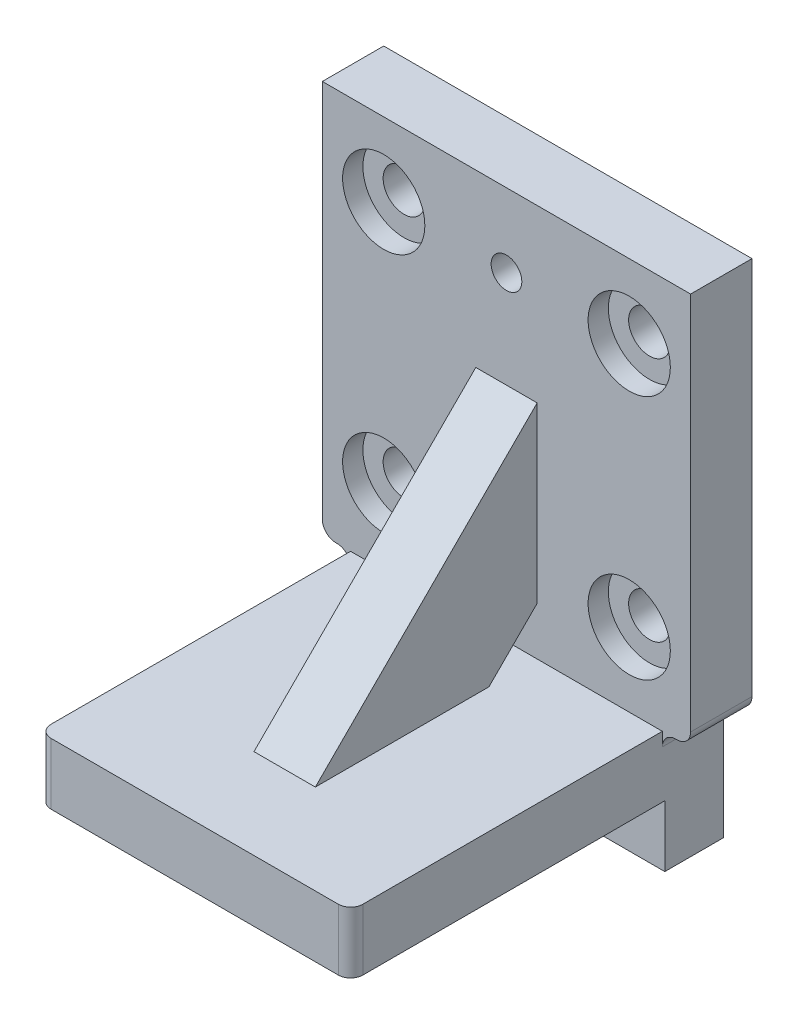
from build123d import *

# Parameters (mm, degrees)
SKETCH1_W                       = 30
SKETCH1_H                       = 32
BOSS_EXTRUDE1_DEPTH             = 5
CBORE_FOR_M3_SBHCS2_D           = 3.4
CBORE_FOR_M3_SBHCS2_CBORE_D     = 6.7
CBORE_FOR_M3_SBHCS2_CBORE_DEPTH = 1.65
TAP_DRILL_FOR_M3X0_5_TAP1_D     = 2.5
SKETCH5_W                       = 25.4
SKETCH5_H                       = 30.4
BOSS_EXTRUDE2_DEPTH             = 5
BOSS_EXTRUDE3_REACH             = 38.377
SKETCH8_W                       = 5
SKETCH8_H                       = 10
BOSS_EXTRUDE3_DIRECTION_2_REACH = 38.377
SKETCH10_W                      = 6.6
SKETCH10_H                      = 19.4
CUT_EXTRUDE1_DEPTH              = 2.7
FILLET1_R                       = 1
SKETCH12_W                      = 25.4
SKETCH12_H                      = 4.8
BOSS_EXTRUDE5_DEPTH             = 5
FILLET2_START                   = -1
FILLET2_DEPTH                   = 30.4
FILLET2_2_DEPTH                 = 5


with BuildPart() as part:
    # Sketch1 → Boss-Extrude1 (new body)
    with BuildSketch(Plane.XY):
        Rectangle(SKETCH1_W, SKETCH1_H)
    extrude(amount=BOSS_EXTRUDE1_DEPTH)

    # CBORE for M3 SBHCS2 (through all)
    with Locations(Plane.XY.offset(5)):
        with Locations((-10, 10), (-10, -10), (10, -10), (10, 10)):
            CounterBoreHole(CBORE_FOR_M3_SBHCS2_D / 2, CBORE_FOR_M3_SBHCS2_CBORE_D / 2, CBORE_FOR_M3_SBHCS2_CBORE_DEPTH)

    # Tap Drill for M3x0.5 Tap1 (through all)
    with Locations(Plane.XY.offset(5)):
        with Locations((0, 10)):
            Hole(TAP_DRILL_FOR_M3X0_5_TAP1_D / 2)

    # Sketch5 → Boss-Extrude2 (add)
    with BuildSketch(Plane.XZ.offset(16)):
        with Locations((0, 15.2)):
            Rectangle(SKETCH5_W, SKETCH5_H)
    extrude(amount=BOSS_EXTRUDE2_DEPTH)

    # Boss-Extrude3: up to this plane
    boss_extrude3_end = Plane(origin=(0, -16, 0), z_dir=(0, -1, 0))
    # Sketch8 → Boss-Extrude3 (add, up to the surface)
    with BuildSketch(Plane(origin=(0, -10.5, 10.5), x_dir=(1, 0, 0), z_dir=(0, -0.7071067811865475, 0.7071067811865477)), mode=Mode.PRIVATE) as boss_extrude3_sk1:
        Rectangle(SKETCH8_W, SKETCH8_H)
    boss_extrude3_tool1 = split(extrude(boss_extrude3_sk1.sketch, amount=BOSS_EXTRUDE3_REACH, mode=Mode.PRIVATE), bisect_by=boss_extrude3_end, keep=Keep.BOTH, mode=Mode.PRIVATE)
    add(boss_extrude3_tool1.solids().sort_by_distance((0, -10.5, 10.5))[0])

    # Boss-Extrude3 direction 2: up to this plane
    boss_extrude3_direction_2_end = Plane(origin=(0, 0, 5), z_dir=(0, 0, 1))
    # Sketch8 → Boss-Extrude3 direction 2 (add, up to the surface)
    with BuildSketch(Plane(origin=(0, -10.5, 10.5), x_dir=(1, 0, 0), z_dir=(0, -0.7071067811865475, 0.7071067811865477)), mode=Mode.PRIVATE) as boss_extrude3_direction_2_sk1:
        Rectangle(SKETCH8_W, SKETCH8_H)
    boss_extrude3_direction_2_tool1 = split(extrude(boss_extrude3_direction_2_sk1.sketch, amount=-BOSS_EXTRUDE3_DIRECTION_2_REACH, mode=Mode.PRIVATE), bisect_by=boss_extrude3_direction_2_end, keep=Keep.BOTH, mode=Mode.PRIVATE)
    add(boss_extrude3_direction_2_tool1.solids().sort_by_distance((0, -10.5, 10.5))[0])

    # Sketch10 → Cut-Extrude1 (cut)
    with BuildSketch(Plane.XZ.offset(21)):
        with Locations((0, 14.7)):
            Rectangle(SKETCH10_W, SKETCH10_H)
    extrude(amount=-CUT_EXTRUDE1_DEPTH, mode=Mode.SUBTRACT)

    # Fillet1
    fillet1_edges = [part.edges().sort_by_distance(p)[0] for p in [
        (12.7, -18.5, 30.4),
        (-12.7, -18.5, 30.4),
    ]]
    fillet(fillet1_edges, radius=FILLET1_R)

    # Sketch12 → Boss-Extrude5 (add)
    with BuildSketch(Plane.XZ.offset(21)):
        with Locations((0, 2.4)):
            Rectangle(SKETCH12_W, SKETCH12_H)
    extrude(amount=BOSS_EXTRUDE5_DEPTH)

    # Fillet2: read off the stored shape, not the designer's step
    # Fillet2 outline → Fillet2 (cut)
    with BuildSketch(Plane.XY.offset(FILLET2_START)):
        with BuildLine():
            Line((15, -16), (15, -14.9))
            ThreePointArc((15, -14.9), (14.677817459, -15.677817459), (13.9, -16))
            Line((13.9, -16), (15, -16))
        make_face()
        with BuildLine():
            Line((-15, -16), (-13.9, -16))
            ThreePointArc((-13.9, -16), (-14.677817459, -15.677817459), (-15, -14.9))
            Line((-15, -14.9), (-15, -16))
        make_face()
    extrude(amount=FILLET2_DEPTH, mode=Mode.SUBTRACT)

    # Fillet2 2 outline → Fillet2 2 (add)
    with BuildSketch(Plane.XY):
        with BuildLine():
            ThreePointArc((12.7, -17.1), (13.022182541, -16.322182541), (13.8, -16))
            Line((13.8, -16), (12.7, -16))
            Line((12.7, -16), (12.7, -17.1))
        make_face()
        with BuildLine():
            Line((-12.7, -16), (-13.8, -16))
            ThreePointArc((-13.8, -16), (-13.022182541, -16.322182541), (-12.7, -17.1))
            Line((-12.7, -17.1), (-12.7, -16))
        make_face()
    extrude(amount=FILLET2_2_DEPTH)


solid = part.part
